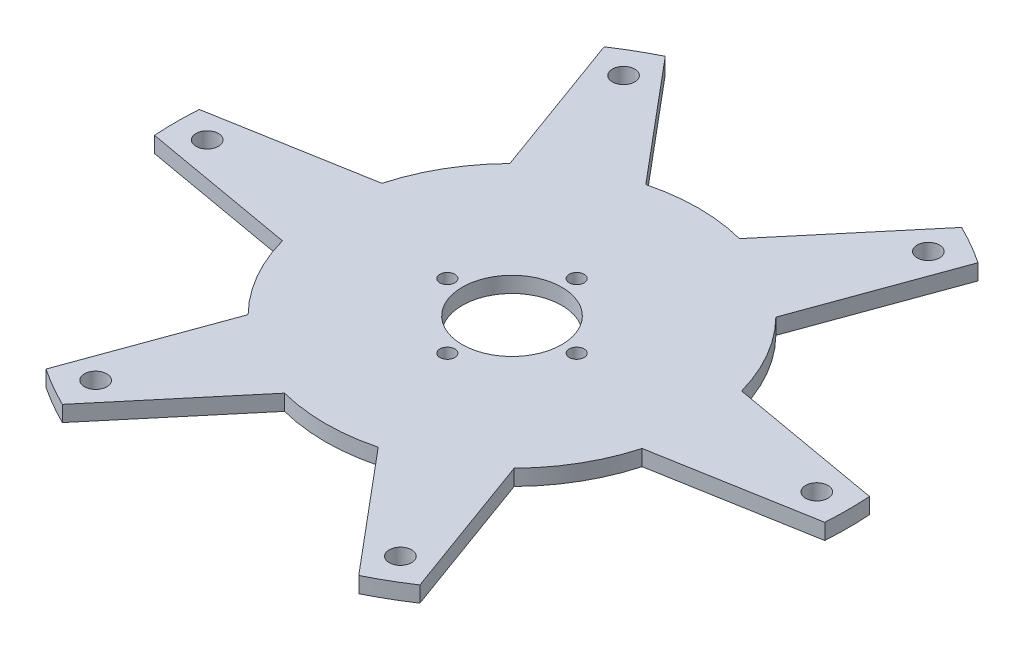
from build123d import *

# Parameters (mm, degrees)
SKETCH2_R           = 10
SKETCH2_R_2         = 1.5
SKETCH2_R_3         = 2.25
BOSS_EXTRUDE1_DEPTH = 3.175


with BuildPart() as part:
    # Sketch2 → Boss-Extrude1 (new body)
    with BuildSketch(Plane(origin=(0, 0, 0), x_dir=(1, 0, 0), z_dir=(0, 1, 0))):
        with BuildLine():
            Line((-36.142080737, 10), (-67.350020101, 4.497198278))
            ThreePointArc((-67.350020101, 4.497198278), (-67.5, 0), (-67.350020101, -4.497198278))
            Line((-67.350020101, -4.497198278), (-36.142080737, -10))
            ThreePointArc((-36.142080737, -10), (-32.475952642, -18.75), (-26.731294406, -26.299960064))
            Line((-26.731294406, -26.299960064), (-37.569698005, -56.078229214))
            ThreePointArc((-37.569698005, -56.078229214), (-33.75, -58.456714755), (-29.780322096, -60.575427492))
            Line((-29.780322096, -60.575427492), (-9.410786331, -36.299960064))
            ThreePointArc((-9.410786331, -36.299960064), (0, -37.5), (9.410786331, -36.299960064))
            Line((9.410786331, -36.299960064), (29.780322096, -60.575427492))
            ThreePointArc((29.780322096, -60.575427492), (33.75, -58.456714755), (37.569698005, -56.078229214))
            Line((37.569698005, -56.078229214), (26.731294406, -26.299960064))
            ThreePointArc((26.731294406, -26.299960064), (32.475952642, -18.75), (36.142080737, -10))
            Line((36.142080737, -10), (67.350020101, -4.497198278))
            ThreePointArc((67.350020101, -4.497198278), (67.5, 0), (67.350020101, 4.497198278))
            Line((67.350020101, 4.497198278), (36.142080737, 10))
            ThreePointArc((36.142080737, 10), (32.475952642, 18.75), (26.731294406, 26.299960064))
            Line((26.731294406, 26.299960064), (37.569698005, 56.078229214))
            ThreePointArc((37.569698005, 56.078229214), (33.75, 58.456714755), (29.780322096, 60.575427492))
            Line((29.780322096, 60.575427492), (9.410786331, 36.299960064))
            ThreePointArc((9.410786331, 36.299960064), (0, 37.5), (-9.410786331, 36.299960064))
            Line((-9.410786331, 36.299960064), (-29.780322096, 60.575427492))
            ThreePointArc((-29.780322096, 60.575427492), (-33.75, 58.456714755), (-37.569698005, 56.078229214))
            Line((-37.569698005, 56.078229214), (-26.731294406, 26.299960064))
            ThreePointArc((-26.731294406, 26.299960064), (-32.475952642, 18.75), (-36.142080737, 10))
        make_face()
        Circle(SKETCH2_R, mode=Mode.SUBTRACT)
        with Locations((0, 13)):
            Circle(SKETCH2_R_2, mode=Mode.SUBTRACT)
        with Locations((13, 0)):
            Circle(SKETCH2_R_2, mode=Mode.SUBTRACT)
        with Locations((0, -13)):
            Circle(SKETCH2_R_2, mode=Mode.SUBTRACT)
        with Locations((-13, 0)):
            Circle(SKETCH2_R_2, mode=Mode.SUBTRACT)
        with Locations((-61.25, 0)):
            Circle(SKETCH2_R_3, mode=Mode.SUBTRACT)
        with Locations((-30.625, 53.044055982)):
            Circle(SKETCH2_R_3, mode=Mode.SUBTRACT)
        with Locations((30.625, 53.044055982)):
            Circle(SKETCH2_R_3, mode=Mode.SUBTRACT)
        with Locations((61.25, 0)):
            Circle(SKETCH2_R_3, mode=Mode.SUBTRACT)
        with Locations((30.625, -53.044055982)):
            Circle(SKETCH2_R_3, mode=Mode.SUBTRACT)
        with Locations((-30.625, -53.044055982)):
            Circle(SKETCH2_R_3, mode=Mode.SUBTRACT)
    extrude(amount=BOSS_EXTRUDE1_DEPTH)


solid = part.part
